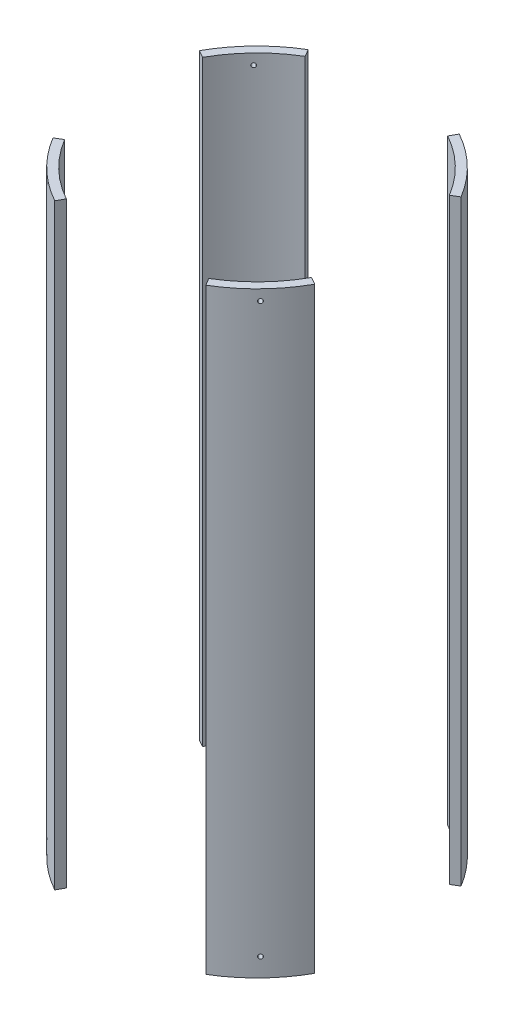
from build123d import *

# Parameters (mm, degrees)
SKETCH2_R               = 88.9
SKETCH2_R_2             = 83.82
BOSS_EXTRUDE1_DEPTH     = 178.3715
CUT_EXTRUDE1_DEPTH      = 219.226515374
CUT_EXTRUDE1_DEPTH_BACK = 219.226515374
SKETCH5_R               = 1.27
BOLT_HOLES_DEPTH        = 262.226509655
BOLT_PATTERN_COUNT      = 4


with BuildPart() as part:
    # Sketch2 → Boss-Extrude1 (new, symmetric)
    with BuildSketch(Plane(origin=(0, 0, 0), x_dir=(1, 0, 0), z_dir=(0, 1, 0))):
        Circle(SKETCH2_R)
        Circle(SKETCH2_R_2, mode=Mode.SUBTRACT)
    extrude(amount=BOSS_EXTRUDE1_DEPTH, both=True)

    # Sketch3 → Cut-Extrude1 (cut, two sides: drawn at the far end of the back side and taken through both)
    with BuildSketch(Plane(origin=(0, 0, 0), x_dir=(1, 0, 0), z_dir=(0, 1, 0)).offset(-CUT_EXTRUDE1_DEPTH_BACK)):
        Polygon((-58.116685864, 96.974944394), (0, 0), (53.900027233, 96.974944394), align=None)
        Polygon((70.991745134, -118.45858783), (0, 0), (-65.840936026, -118.45858783), align=None)
        Polygon((169.661755759, 101.677593364), (0, 0), (169.661755759, -94.300371224), align=None)
        Polygon((-123.741299607, -74.157652604), (0, 0), (-123.741299607, 68.777140945), align=None)
    extrude(amount=CUT_EXTRUDE1_DEPTH + CUT_EXTRUDE1_DEPTH_BACK, mode=Mode.SUBTRACT)


with BuildPart() as cut_extrude1_piece_1:
    # of the separate pieces the step leaves, piece 1, a body of its own (cut_extrude1_pieces)
    add(part.part.solids().sort_by_distance((-45.699187432, -178.3715, -76.254798328))[0])


with BuildPart() as cut_extrude1_piece_2:
    # of the separate pieces the step leaves, piece 2, a body of its own (cut_extrude1_pieces)
    add(part.part.solids().sort_by_distance((45.699187432, -178.3715, 76.254798328))[0])


with BuildPart() as cut_extrude1_piece_3:
    # of the separate pieces the step leaves, piece 3, a body of its own (cut_extrude1_pieces)
    add(part.part.solids().sort_by_distance((76.254798328, -178.3715, -45.699187432))[0])


with BuildPart() as cut_extrude1_piece_4:
    # of the separate pieces the step leaves, piece 4, a body of its own (cut_extrude1_pieces)
    add(part.part.solids().sort_by_distance((-76.254798328, -178.3715, 45.699187432))[0])

    # Sketch5 → Bolt holes (cut, through all)
    with BuildSketch(Plane(origin=(-56.309218645, 0, 58.175814955), x_dir=(-0.7185401515036821, 0, -0.6954854784084752), z_dir=(0.6954854784084752, 0, -0.7185401515036821))):
        with Locations((-0.02278764, 172.0215)):
            Circle(SKETCH5_R)
        with Locations((-0.02278764, -167.259)):
            Circle(SKETCH5_R)
    bolt_holes = extrude(amount=-BOLT_HOLES_DEPTH, mode=Mode.SUBTRACT)


with BuildPart() as bolt_pattern_tool:
    # Bolt pattern: Bolt holes ×4 about axis
    bolt_pattern_axis = Axis((0, 178.3715, 0), (0, 1, 0))
    for i in range(1, BOLT_PATTERN_COUNT):
        add(bolt_holes.rotate(bolt_pattern_axis, i * 360 / BOLT_PATTERN_COUNT))


with BuildPart() as cut_extrude1_piece_1_1:
    add(cut_extrude1_piece_1.part)

    # Bolt pattern: cut by bolt_pattern_tool
    add(bolt_pattern_tool.part, mode=Mode.SUBTRACT)


with BuildPart() as cut_extrude1_piece_2_1:
    add(cut_extrude1_piece_2.part)

    # Bolt pattern: cut by bolt_pattern_tool
    add(bolt_pattern_tool.part, mode=Mode.SUBTRACT)


with BuildPart() as cut_extrude1_piece_3_1:
    add(cut_extrude1_piece_3.part)

    # Bolt pattern: cut by bolt_pattern_tool
    add(bolt_pattern_tool.part, mode=Mode.SUBTRACT)


solid = Compound([cut_extrude1_piece_4.part, cut_extrude1_piece_1_1.part, cut_extrude1_piece_2_1.part, cut_extrude1_piece_3_1.part])
